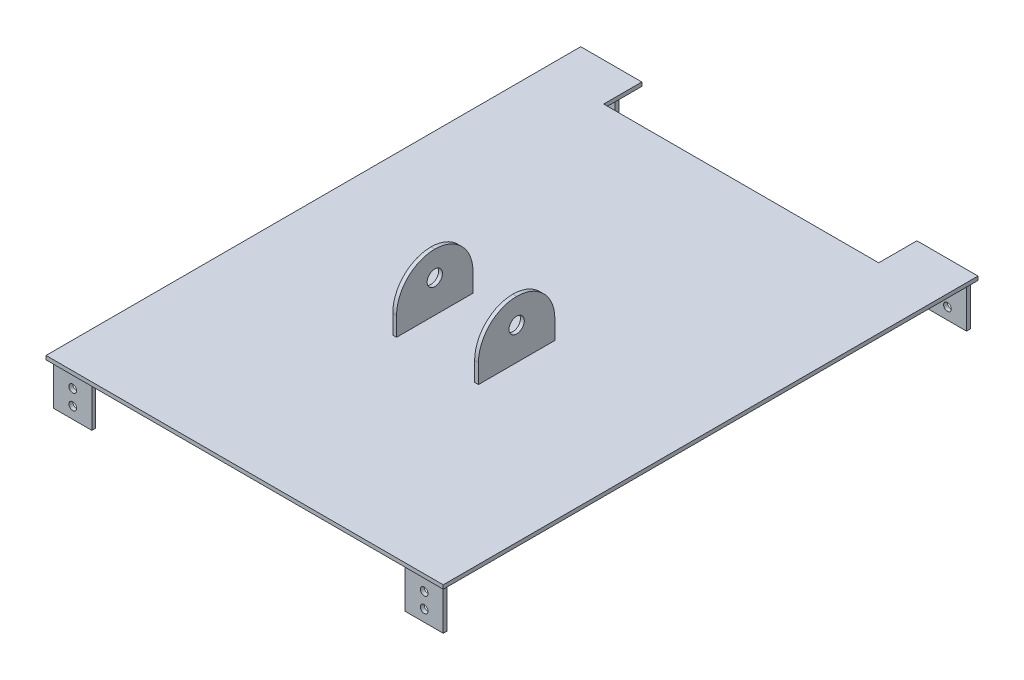
from build123d import *

# Parameters (mm, degrees)
SKETCH1_W           = 104
SKETCH1_H           = 140
BOSS_EXTRUDE1_DEPTH = 1
SKETCH2_W           = 1
SKETCH2_H           = 20
BOSS_EXTRUDE2_DEPTH = 15
SKETCH6_R           = 2
CUT_EXTRUDE1_DEPTH  = 30
FILLET3_R           = 10
FILLET4_R           = 10
FILLET5_R           = 10
FILLET6_R           = 10
SKETCH9_W           = 10
SKETCH9_H           = 1
BOSS_EXTRUDE5_DEPTH = 11
SKETCH10_R          = 1
CUT_EXTRUDE2_DEPTH  = 150.268214969
SKETCH12_R          = 1
CUT_EXTRUDE3_DEPTH  = 150.268214969
CUT_EXTRUDE4_DEPTH  = 12


with BuildPart() as part:
    # Sketch1 → Boss-Extrude1 (new body)
    with BuildSketch(Plane(origin=(0, 0, 0), x_dir=(1, 0, 0), z_dir=(0, 1, 0))):
        Rectangle(SKETCH1_W, SKETCH1_H)
    extrude(amount=BOSS_EXTRUDE1_DEPTH)

    # Sketch2 → Boss-Extrude2 (add)
    with BuildSketch(Plane(origin=(0, 1, 0), x_dir=(1, 0, 0), z_dir=(0, 1, 0))):
        with Locations((-10.719821852, -10)):
            Rectangle(SKETCH2_W, SKETCH2_H)
        with Locations((10.719821852, -10)):
            Rectangle(SKETCH2_W, SKETCH2_H)
    extrude(amount=BOSS_EXTRUDE2_DEPTH)

    # Sketch6 → Cut-Extrude1 (cut)
    with BuildSketch(Plane(origin=(11.219821852, 0, 0), x_dir=(0, 0, -1), z_dir=(1, 0, 0))):
        with Locations((-10, 9.5)):
            Circle(SKETCH6_R)
    extrude(amount=-CUT_EXTRUDE1_DEPTH, mode=Mode.SUBTRACT)

    # Fillet3
    fillet3_edges = [part.edges().sort_by_distance(p)[0] for p in [
        (10.719821852, 16, 20),
    ]]
    fillet(fillet3_edges, radius=FILLET3_R)

    # Fillet4
    fillet4_edges = [part.edges().sort_by_distance(p)[0] for p in [
        (10.719821852, 16, 0),
    ]]
    fillet(fillet4_edges, radius=FILLET4_R - 0.0001)  # a hair under: the kernel refuses the full size

    # Fillet5
    fillet5_edges = [part.edges().sort_by_distance(p)[0] for p in [
        (-10.719821852, 16, 20),
    ]]
    fillet(fillet5_edges, radius=FILLET5_R)

    # Fillet6
    fillet6_edges = [part.edges().sort_by_distance(p)[0] for p in [
        (-10.719821852, 16, 0),
    ]]
    fillet(fillet6_edges, radius=FILLET6_R - 0.0001)  # a hair under: the kernel refuses the full size

    # Sketch9 → Boss-Extrude5 (add)
    with BuildSketch(Plane.XZ):
        with Locations((46, -68.5)):
            Rectangle(SKETCH9_W, SKETCH9_H)
        with Locations((-46, -68.5)):
            Rectangle(SKETCH9_W, SKETCH9_H)
        with Locations((-46, 68.5)):
            Rectangle(SKETCH9_W, SKETCH9_H)
        with Locations((46, 68.5)):
            Rectangle(SKETCH9_W, SKETCH9_H)
    extrude(amount=BOSS_EXTRUDE5_DEPTH)

    # Sketch10 → Cut-Extrude2 (cut, through all)
    with BuildSketch(Plane(origin=(0, 0, -69), x_dir=(-1, 0, 0), z_dir=(0, 0, -1))):
        with Locations((46, -8)):
            Circle(SKETCH10_R)
        with Locations((46, -4)):
            Circle(SKETCH10_R)
    extrude(amount=-CUT_EXTRUDE2_DEPTH, mode=Mode.SUBTRACT)

    # Sketch12 → Cut-Extrude3 (cut, through all)
    with BuildSketch(Plane.XY.offset(69)):
        with Locations((46, -4)):
            Circle(SKETCH12_R)
        with Locations((46, -8)):
            Circle(SKETCH12_R)
    extrude(amount=-CUT_EXTRUDE3_DEPTH, mode=Mode.SUBTRACT)

    # Sketch13 → Cut-Extrude4 (cut)
    with BuildSketch(Plane(origin=(0, 1, 0), x_dir=(1, 0, 0), z_dir=(0, 1, 0))):
        Polygon((0, 70), (-36, 70), (-36, 60), (36, 60), (36, 70), align=None)
    extrude(amount=-CUT_EXTRUDE4_DEPTH, mode=Mode.SUBTRACT)


solid = part.part
